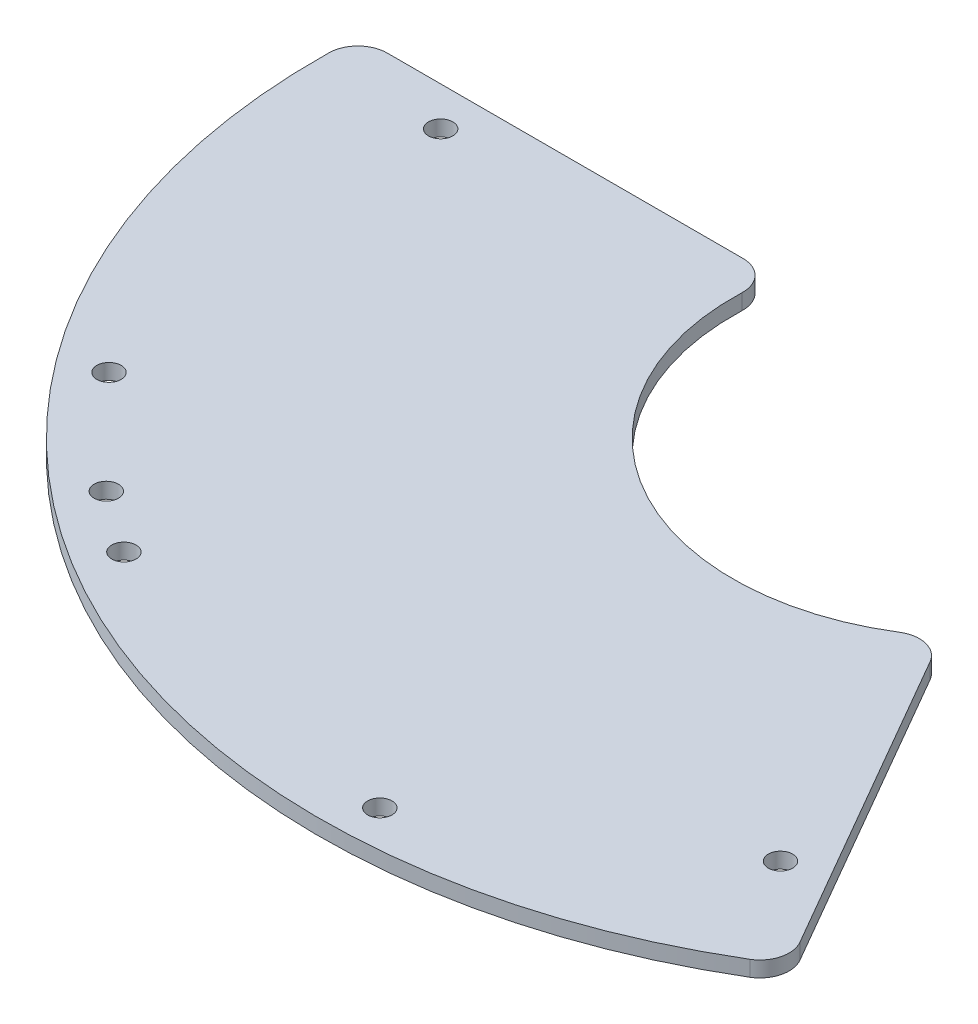
from build123d import *

# Parameters (mm, degrees)
SKETCH1_R           = 1.25
BOSS_EXTRUDE1_DEPTH = 0.8
FILLET1_R           = 3


with BuildPart() as part:
    # Sketch1 → Boss-Extrude1 (new, symmetric)
    with BuildSketch(Plane(origin=(0, 0, 0), x_dir=(1, 0, 0), z_dir=(0, 1, 0))):
        with BuildLine():
            Line((-67.381377249, 4), (-24.677925359, 4))
            ThreePointArc((-24.677925359, 4), (-12.5, -21.650635095), (15.803064294, -19.371710273))
            Line((15.803064294, -19.371710273), (37.15479024, -56.35398444))
            ThreePointArc((37.15479024, -56.35398444), (-33.75, -58.456714755), (-67.381377249, 4))
        make_face()
        with Locations((-55, 0)):
            Circle(SKETCH1_R, mode=Mode.SUBTRACT)
        with Locations((27.5, -47.631397208)):
            Circle(SKETCH1_R, mode=Mode.SUBTRACT)
        with Locations((2.216118041, -63.461317516)):
            Circle(SKETCH1_R, mode=Mode.SUBTRACT)
        with Locations((-33.649873279, -53.851054106)):
            Circle(SKETCH1_R, mode=Mode.SUBTRACT)
        with Locations((-39.961844832, -49.348768553)):
            Circle(SKETCH1_R, mode=Mode.SUBTRACT)
        with Locations((-50.377937108, -38.656350742)):
            Circle(SKETCH1_R, mode=Mode.SUBTRACT)
    extrude(amount=BOSS_EXTRUDE1_DEPTH, both=True)

    # Fillet1
    fillet1_edges = [part.edges().sort_by_distance(p)[0] for p in [
        (-67.381377249, 0, -4),
        (-24.677925359, 0, -4),
        (37.15479024, 0, 56.35398444),
        (15.803064294, 0, 19.371710273),
    ]]
    fillet(fillet1_edges, radius=FILLET1_R)


solid = part.part
